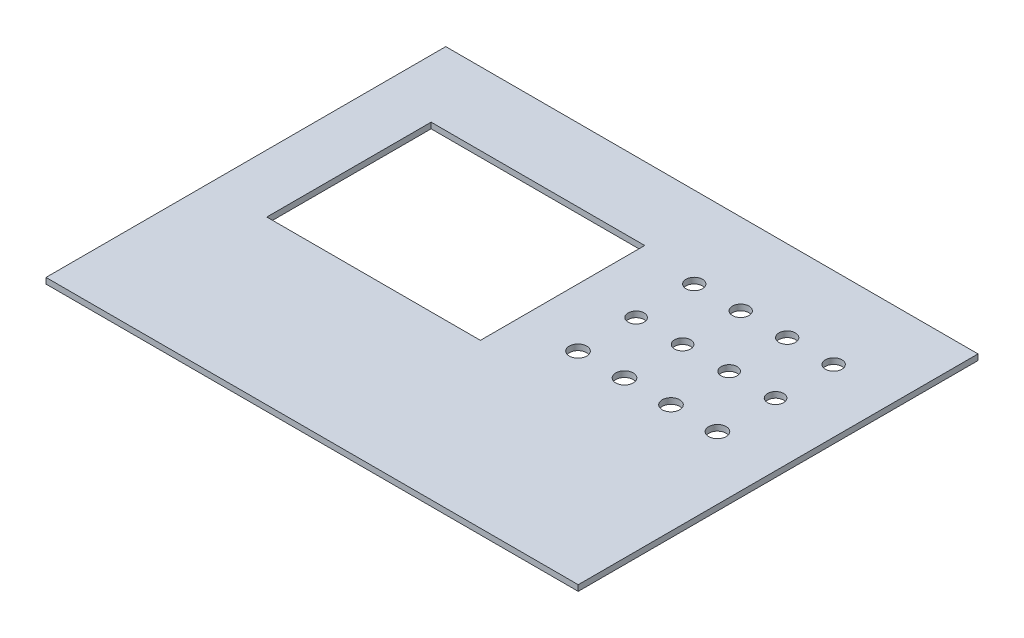
from build123d import *

# Parameters (mm, degrees)
SKETCH1_W           = 581.66
SKETCH1_H           = 436.88
BOSS_EXTRUDE1_DEPTH = 6.35
SKETCH3_W           = 233.426
SKETCH3_H           = 179.578
CUT_EXTRUDE2_DEPTH  = 728.483891574
SKETCH4_R           = 9.017
CUT_EXTRUDE3_DEPTH  = 728.483891574
SKETCH5_R           = 8.763
CUT_EXTRUDE4_DEPTH  = 728.483891574
SKETCH6_R           = 9.525
CUT_EXTRUDE5_DEPTH  = 728.483891574


with BuildPart() as part:
    # Sketch1 → Boss-Extrude1 (new body)
    with BuildSketch(Plane(origin=(0, 0, 0), x_dir=(1, 0, 0), z_dir=(0, 1, 0))):
        with Locations((290.83, 218.44)):
            Rectangle(SKETCH1_W, SKETCH1_H)
    extrude(amount=BOSS_EXTRUDE1_DEPTH)

    # Sketch3 → Cut-Extrude2 (cut, through all)
    with BuildSketch(Plane(origin=(0, 6.35, 0), x_dir=(1, 0, 0), z_dir=(0, 1, 0))):
        with Locations((180.213, 267.589)):
            Rectangle(SKETCH3_W, SKETCH3_H)
    extrude(amount=-CUT_EXTRUDE2_DEPTH, mode=Mode.SUBTRACT)

    # Sketch4 → Cut-Extrude3 (cut, through all)
    with BuildSketch(Plane(origin=(0, 6.35, 0), x_dir=(1, 0, 0), z_dir=(0, 1, 0))):
        with Locations((360.426, 347.98)):
            Circle(SKETCH4_R)
        with Locations((411.226, 347.98)):
            Circle(SKETCH4_R)
        with Locations((462.026, 347.98)):
            Circle(SKETCH4_R)
        with Locations((512.826, 347.98)):
            Circle(SKETCH4_R)
    extrude(amount=-CUT_EXTRUDE3_DEPTH, mode=Mode.SUBTRACT)

    # Sketch5 → Cut-Extrude4 (cut, through all)
    with BuildSketch(Plane(origin=(0, 6.35, 0), x_dir=(1, 0, 0), z_dir=(0, 1, 0))):
        with Locations((360.426, 284.48)):
            Circle(SKETCH5_R)
        with Locations((411.226, 284.48)):
            Circle(SKETCH5_R)
        with Locations((462.026, 284.48)):
            Circle(SKETCH5_R)
        with Locations((512.826, 284.48)):
            Circle(SKETCH5_R)
    extrude(amount=-CUT_EXTRUDE4_DEPTH, mode=Mode.SUBTRACT)

    # Sketch6 → Cut-Extrude5 (cut, through all)
    with BuildSketch(Plane(origin=(0, 6.35, 0), x_dir=(1, 0, 0), z_dir=(0, 1, 0))):
        with Locations((360.426, 220.98)):
            Circle(SKETCH6_R)
        with Locations((411.226, 220.98)):
            Circle(SKETCH6_R)
        with Locations((462.026, 220.98)):
            Circle(SKETCH6_R)
        with Locations((512.826, 220.98)):
            Circle(SKETCH6_R)
    extrude(amount=-CUT_EXTRUDE5_DEPTH, mode=Mode.SUBTRACT)


solid = part.part
